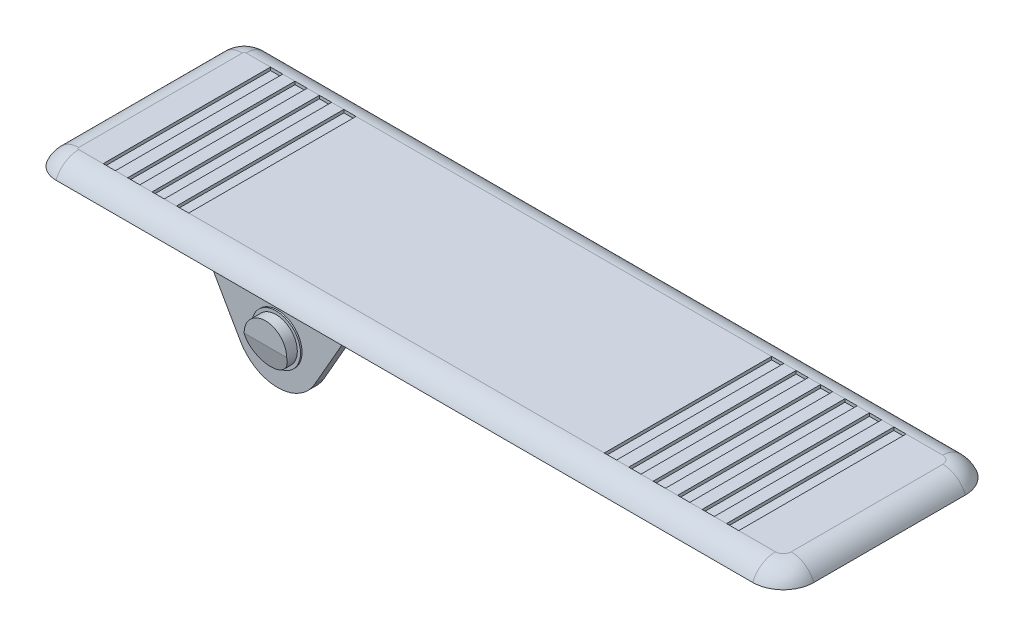
from build123d import *

# Parameters (mm, degrees)
BASE_EXTRUDE_DEPTH   = 2.5
FILLET1_R            = 4
BOSS_EXTRUDE1_DEPTH  = 1.5
FILLET2_R            = 0.75
SKETCH4_R            = 4
BOSS_EXTRUDE2_DEPTH  = 0.25
SKETCH5_R            = 3.475
BOSS_EXTRUDE7_DEPTH  = 2
CUT_EXTRUDE2_DEPTH   = 129.647930415
FILLET2_OF_MIRROR1_R = 0.75
BOSS_EXTRUDE8_DEPTH  = 0.75
FILLET3_R            = 0.75
SKETCH8_R            = 9.25
SKETCH8_R_2          = 8
BOSS_EXTRUDE9_DEPTH  = 1.8
SKETCH9_W            = 2
SKETCH9_H            = 27.383801512
CUT_EXTRUDE3_DEPTH   = 0.5
LPATTERN1_COUNT      = 6
LPATTERN1_PITCH      = 4
SKETCH10_W           = 2
SKETCH10_H           = 27.383801512
CUT_EXTRUDE4_DEPTH   = 0.5
LPATTERN2_COUNT      = 4
LPATTERN2_PITCH      = 4


# Some blends are built 0.0001 mm under size
with BuildPart() as part:
    # Sketch1 → Base-Extrude (new body)
    with BuildSketch(Plane(origin=(0, 0, 0), x_dir=(1, 0, 0), z_dir=(0, 1, 0))):
        with BuildLine():
            Line((4, 0), (118, 0))
            ThreePointArc((118, 0), (121.535533906, 1.464466094), (123, 5))
            Line((123, 5), (123, 29.8))
            ThreePointArc((123, 29.8), (121.535533906, 33.335533906), (118, 34.8))
            Line((118, 34.8), (4, 34.8))
            ThreePointArc((4, 34.8), (1.171572875, 33.628427125), (0, 30.8))
            Line((0, 30.8), (0, 4))
            ThreePointArc((0, 4), (1.171572875, 1.171572875), (4, 0))
        make_face()
    extrude(amount=BASE_EXTRUDE_DEPTH)

    # Fillet1
    # the kernel refuses this fillet: 4 mm, written as the material it takes off along each edge
    with BuildSketch(Plane(origin=(118, 2.5, -5), x_dir=(0, 0, 1), z_dir=(-1, 0, 0))) as fillet1_piece_1:
        with BuildLine():
            CenterArc((1.291900756, -4), FILLET1_R, 22.024312837, 67.975687163)
            Line((1.291900756, 0), (1.291900756, 0.08))
            Line((1.291900756, 0.08), (5, 0.08))
            Line((5, 0.08), (5.08, 0))
            ThreePointArc((5.08, 0), (5.08, -1.25), (5.074161985, -2.47))
            Line((5.074161985, -2.47), (5, -2.5))
        make_face()
    revolve(axis=Axis((118, 2.5, -5), (0, 1, 0)), revolution_arc=90, mode=Mode.SUBTRACT)
    with BuildSketch(Plane(origin=(123, 2.5, -5), x_dir=(0, -1, 0), z_dir=(0, 0, -1))) as fillet1_piece_2:
        with BuildLine():
            CenterArc((4, 3.708099244), FILLET1_R, 180, 67.975687163)
            Line((0, 3.708099244), (-0.08, 3.708099244))
            Line((-0.08, 3.708099244), (-0.08, 0))
            Line((-0.08, 0), (0, -0.08))
            ThreePointArc((0, -0.08), (1.25, -0.08), (2.47, -0.074161985))
            Line((2.47, -0.074161985), (2.5, 0))
        make_face()
    extrude(amount=24.8, mode=Mode.SUBTRACT)
    with BuildSketch(Plane(origin=(118, 2.5, -29.8), x_dir=(1, 0, 0), z_dir=(0, 0, 1))) as fillet1_piece_3:
        with BuildLine():
            CenterArc((1.291900756, -4), FILLET1_R, 22.024312837, 67.975687163)
            Line((1.291900756, 0), (1.291900756, 0.08))
            Line((1.291900756, 0.08), (5, 0.08))
            Line((5, 0.08), (5.08, 0))
            ThreePointArc((5.08, 0), (5.08, -1.25), (5.074161985, -2.47))
            Line((5.074161985, -2.47), (5, -2.5))
        make_face()
    revolve(axis=Axis((118, 2.5, -29.8), (0, 1, 0)), revolution_arc=90, mode=Mode.SUBTRACT)
    with BuildSketch(Plane(origin=(118, 2.5, -34.8), x_dir=(0, -1, 0), z_dir=(-1, 0, 0)), Plane(origin=(4, 2.5, 0), x_dir=(0, -1, 0), z_dir=(1, 0, 0))) as fillet1_piece_4:
        with BuildLine():
            CenterArc((4, 3.708099244), FILLET1_R, 180, 67.975687163)
            Line((0, 3.708099244), (-0.08, 3.708099244))
            Line((-0.08, 3.708099244), (-0.08, 0))
            Line((-0.08, 0), (0, -0.08))
            ThreePointArc((0, -0.08), (1.25, -0.08), (2.47, -0.074161985))
            Line((2.47, -0.074161985), (2.5, 0))
        make_face()
    extrude(amount=114, mode=Mode.SUBTRACT)
    with BuildSketch(Plane(origin=(4, 2.5, -30.8), x_dir=(0, 0, -1), z_dir=(1, 0, 0))) as fillet1_piece_5:
        with BuildLine():
            CenterArc((0.291900756, -4), FILLET1_R, 22.024312837, 67.975687163)
            Line((0.291900756, 0), (0.291900756, 0.08))
            Line((0.291900756, 0.08), (4, 0.08))
            Line((4, 0.08), (4.08, 0))
            ThreePointArc((4.08, 0), (4.08, -1.25), (4.074161985, -2.47))
            Line((4.074161985, -2.47), (4, -2.5))
        make_face()
    revolve(axis=Axis((4, 2.5, -30.8), (0, 1, 0)), revolution_arc=90, mode=Mode.SUBTRACT)
    with BuildSketch(Plane(origin=(0, 2.5, -30.8), x_dir=(0, -1, 0), z_dir=(0, 0, 1))) as fillet1_piece_6:
        with BuildLine():
            CenterArc((4, 3.708099244), FILLET1_R, 180, 67.975687163)
            Line((0, 3.708099244), (-0.08, 3.708099244))
            Line((-0.08, 3.708099244), (-0.08, 0))
            Line((-0.08, 0), (0, -0.08))
            ThreePointArc((0, -0.08), (1.25, -0.08), (2.47, -0.074161985))
            Line((2.47, -0.074161985), (2.5, 0))
        make_face()
    extrude(amount=26.8, mode=Mode.SUBTRACT)
    with BuildSketch(Plane(origin=(4, 2.5, -4), x_dir=(-1, 0, 0), z_dir=(0, 0, -1))) as fillet1_piece_7:
        with BuildLine():
            CenterArc((0.291900756, -4), FILLET1_R, 22.024312837, 67.975687163)
            Line((0.291900756, 0), (0.291900756, 0.08))
            Line((0.291900756, 0.08), (4, 0.08))
            Line((4, 0.08), (4.08, 0))
            ThreePointArc((4.08, 0), (4.08, -1.25), (4.074161985, -2.47))
            Line((4.074161985, -2.47), (4, -2.5))
        make_face()
    revolve(axis=Axis((4, 2.5, -4), (0, 1, 0)), revolution_arc=90, mode=Mode.SUBTRACT)

    # Sketch3 → Boss-Extrude1 (add)
    with BuildSketch(Plane.XY.offset(-3.25)):
        with BuildLine():
            Line((5, 0), (111, 0))
            Line((111, 0), (111, -1.5))
            Line((111, -1.5), (48.5, -1.5))
            Line((48.5, -1.5), (43.075167447, -10.977404274))
            ThreePointArc((43.075167447, -10.977404274), (37, -14.5), (30.924832553, -10.977404274))
            Line((30.924832553, -10.977404274), (25.5, -1.5))
            Line((25.5, -1.5), (5, -1.5))
            Line((5, -1.5), (5, 0))
        make_face()
    boss_extrude1 = extrude(amount=-BOSS_EXTRUDE1_DEPTH)

    # Fillet2
    fillet2_edges = [part.edges().sort_by_distance(p)[0] for p in [
        (5, -0.75, -4.75),
        (111, -0.75, -3.25),
        (111, -0.75, -4.75),
        (5, -0.75, -3.25),
    ]]
    fillet(fillet2_edges, radius=FILLET2_R - 0.0001)  # a hair under: the kernel refuses the full size

    # Sketch4 → Boss-Extrude2 (add)
    with BuildSketch(Plane.XY.offset(-3.25)):
        with Locations(Location((37, -7.5, 0), (0, 0, 180))):
            Circle(SKETCH4_R)
    boss_extrude2 = extrude(amount=BOSS_EXTRUDE2_DEPTH)

    # Sketch5 → Boss-Extrude7 (add)
    with BuildSketch(Plane.XY.offset(-3.25)):
        with Locations((37, -7.5)):
            Circle(SKETCH5_R)
    boss_extrude7 = extrude(amount=BOSS_EXTRUDE7_DEPTH)

    # Sketch6 → Cut-Extrude2 (cut, through all)
    with BuildSketch(Plane(origin=(0, 0, 0), x_dir=(0, 0, -1), z_dir=(1, 0, 0))):
        Polygon((-18.452365233, 70.746536211), (1.25, -7.5), (2.125, -10.975), (21.827365233, -89.221536211), (-134.665707189, -128.626266677), (-174.945437655, 31.341805745), align=None)
    cut_extrude2 = extrude(amount=CUT_EXTRUDE2_DEPTH, mode=Mode.SUBTRACT)

    # Mirror1: Boss-Extrude1, Boss-Extrude2, Boss-Extrude7, Cut-Extrude2 across plane
    add(boss_extrude1.mirror(Plane.XY.offset(-17.4)))
    add(boss_extrude2.mirror(Plane.XY.offset(-17.4)))
    add(boss_extrude7.mirror(Plane.XY.offset(-17.4)))
    add(cut_extrude2.mirror(Plane.XY.offset(-17.4)), mode=Mode.SUBTRACT)

    # Fillet2 of Mirror1
    fillet2_of_mirror1_edges = [part.edges().sort_by_distance(p)[0] for p in [
        (5, -0.75, -30.05),
        (111, -0.75, -31.55),
        (111, -0.75, -30.05),
        (5, -0.75, -31.55),
    ]]
    fillet(fillet2_of_mirror1_edges, radius=FILLET2_OF_MIRROR1_R - 0.0001)  # a hair under: the kernel refuses the full size

    # Sketch7 → Boss-Extrude8 (add)
    with BuildSketch(Plane.XZ):
        with BuildLine():
            Line((119.5, -30.8), (119.5, -4))
            ThreePointArc((119.5, -4), (118.75, -3.25), (118, -4))
            Line((118, -4), (118, -30.8))
            ThreePointArc((118, -30.8), (118.75, -31.55), (119.5, -30.8))
        make_face()
    extrude(amount=BOSS_EXTRUDE8_DEPTH)

    # Fillet3
    fillet3_edges = [part.edges().sort_by_distance(p)[0] for p in [
        (118.75, -0.75, -31.55),
        (118.75, -0.75, -3.25),
        (119.5, -0.75, -17.4),
        (118, -0.75, -17.4),
    ]]
    fillet(fillet3_edges, radius=FILLET3_R - 0.0001)  # a hair under: the kernel refuses the full size

    # Sketch8 → Boss-Extrude9 (add)
    with BuildSketch(Plane.XZ):
        with Locations(Location((14.5, -17.4, 0), (0, 0, 90))):
            Circle(SKETCH8_R)
        with Locations(Location((14.5, -17.4, 0), (0, 0, 270))):
            Circle(SKETCH8_R_2, mode=Mode.SUBTRACT)
    extrude(amount=BOSS_EXTRUDE9_DEPTH)

    # Sketch9 → Cut-Extrude3 (cut)
    with BuildSketch(Plane(origin=(0, 2.5, 0), x_dir=(-1, 0, 0), z_dir=(0, 1, 0))):
        with Locations((-111, -17.4)):
            Rectangle(SKETCH9_W, SKETCH9_H)
    cut_extrude3 = extrude(amount=-CUT_EXTRUDE3_DEPTH, mode=Mode.SUBTRACT)

    # LPattern1: Cut-Extrude3 ×6
    with Locations(*[(-i * LPATTERN1_PITCH, 0, 0) for i in range(1, LPATTERN1_COUNT)]):
        add(cut_extrude3, mode=Mode.SUBTRACT)

    # Sketch10 → Cut-Extrude4 (cut)
    with BuildSketch(Plane(origin=(-102, 2.5, 0), x_dir=(-1, 0, 0), z_dir=(0, 1, 0))):
        with Locations((-111, -17.4)):
            Rectangle(SKETCH10_W, SKETCH10_H)
    cut_extrude4 = extrude(amount=-CUT_EXTRUDE4_DEPTH, mode=Mode.SUBTRACT)

    # LPattern2: Cut-Extrude4 ×4
    with Locations(*[(i * LPATTERN2_PITCH, 0, 0) for i in range(1, LPATTERN2_COUNT)]):
        add(cut_extrude4, mode=Mode.SUBTRACT)


solid = part.part
